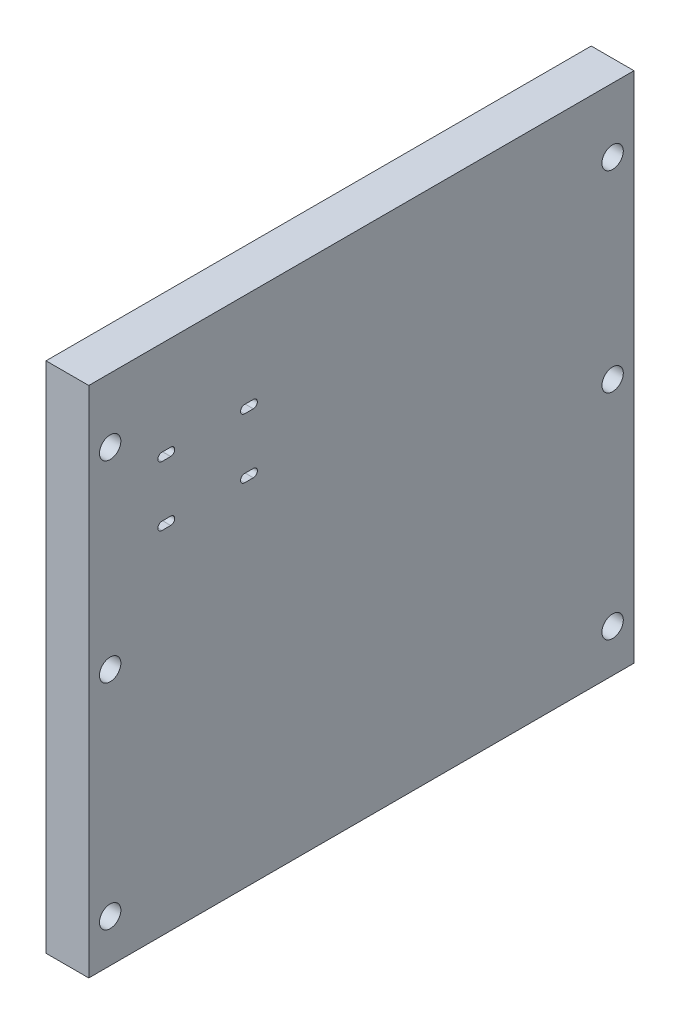
from build123d import *

# Parameters (mm, degrees)
SKETCH1_W           = 161.925
SKETCH1_H           = 152.4
SKETCH1_R           = 3.175
BOSS_EXTRUDE1_DEPTH = 12.7


with BuildPart() as part:
    # Sketch1 → Boss-Extrude1 (new body)
    with BuildSketch(Plane(origin=(0, 0, 0), x_dir=(0, 0, -1), z_dir=(1, 0, 0))):
        with Locations((20.6375, 0)):
            Rectangle(SKETCH1_W, SKETCH1_H)
        with Locations((-53.975, 57.15)):
            Circle(SKETCH1_R, mode=Mode.SUBTRACT)
        with Locations((-53.975, 0)):
            Circle(SKETCH1_R, mode=Mode.SUBTRACT)
        with Locations((-53.975, -63.5)):
            Circle(SKETCH1_R, mode=Mode.SUBTRACT)
        with Locations((95.25, 57.15)):
            Circle(SKETCH1_R, mode=Mode.SUBTRACT)
        with Locations((95.25, 0)):
            Circle(SKETCH1_R, mode=Mode.SUBTRACT)
        with Locations((95.25, -63.5)):
            Circle(SKETCH1_R, mode=Mode.SUBTRACT)
        with BuildLine():
            Line((-38.595, 30.43), (-35.995, 30.43))
            ThreePointArc((-35.995, 30.43), (-34.795, 29.23), (-35.995, 28.03))
            Line((-35.995, 28.03), (-38.595, 28.03))
            ThreePointArc((-38.595, 28.03), (-39.795, 29.23), (-38.595, 30.43))
        make_face(mode=Mode.SUBTRACT)
        with BuildLine():
            Line((-11.455, 28.03), (-14.055, 28.03))
            ThreePointArc((-14.055, 28.03), (-15.255, 29.23), (-14.055, 30.43))
            Line((-14.055, 30.43), (-11.455, 30.43))
            ThreePointArc((-11.455, 30.43), (-10.255, 29.23), (-11.455, 28.03))
        make_face(mode=Mode.SUBTRACT)
        with BuildLine():
            ThreePointArc((-14.055, 45.77), (-15.255, 46.97), (-14.055, 48.17))
            Line((-14.055, 48.17), (-11.455, 48.17))
            ThreePointArc((-11.455, 48.17), (-10.255, 46.97), (-11.455, 45.77))
            Line((-11.455, 45.77), (-14.055, 45.77))
        make_face(mode=Mode.SUBTRACT)
        with BuildLine():
            Line((-38.595, 48.17), (-35.995, 48.17))
            ThreePointArc((-35.995, 48.17), (-34.795, 46.97), (-35.995, 45.77))
            Line((-35.995, 45.77), (-38.595, 45.77))
            ThreePointArc((-38.595, 45.77), (-39.795, 46.97), (-38.595, 48.17))
        make_face(mode=Mode.SUBTRACT)
    extrude(amount=BOSS_EXTRUDE1_DEPTH)


solid = part.part
